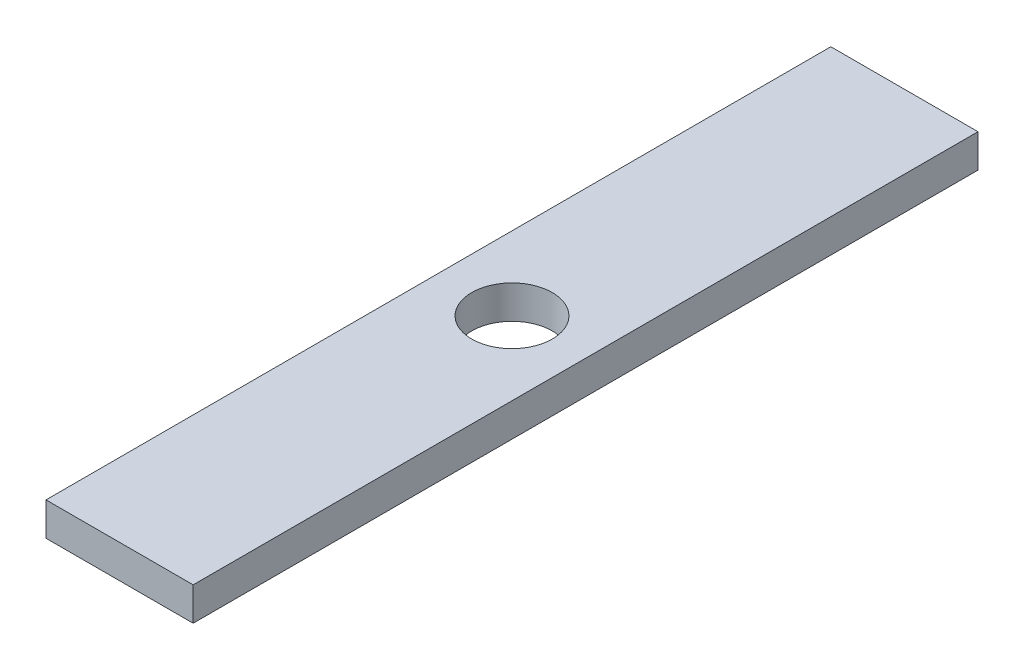
from build123d import *

# Parameters (mm, degrees)
SKETCH_1_W          = 42
SKETCH_1_H          = 224
EXTRUDE_1_DEPTH     = 9.5
SKETCH_2_R          = 11.5
CUT_EXTRUDE_1_DEPTH = 229.101402889


with BuildPart() as part:
    # 草图1 → 凸台-拉伸1 (new body)
    with BuildSketch(Plane(origin=(0, 0, 0), x_dir=(1, 0, 0), z_dir=(0, 1, 0))):
        with Locations((21, -112)):
            Rectangle(SKETCH_1_W, SKETCH_1_H)
    extrude(amount=EXTRUDE_1_DEPTH)

    # 草图2 → 切除-拉伸1 (cut, through all)
    with BuildSketch(Plane(origin=(0, 9.5, 0), x_dir=(1, 0, 0), z_dir=(0, 1, 0))):
        with Locations((21, -112)):
            Circle(SKETCH_2_R)
    extrude(amount=-CUT_EXTRUDE_1_DEPTH, mode=Mode.SUBTRACT)


solid = part.part
